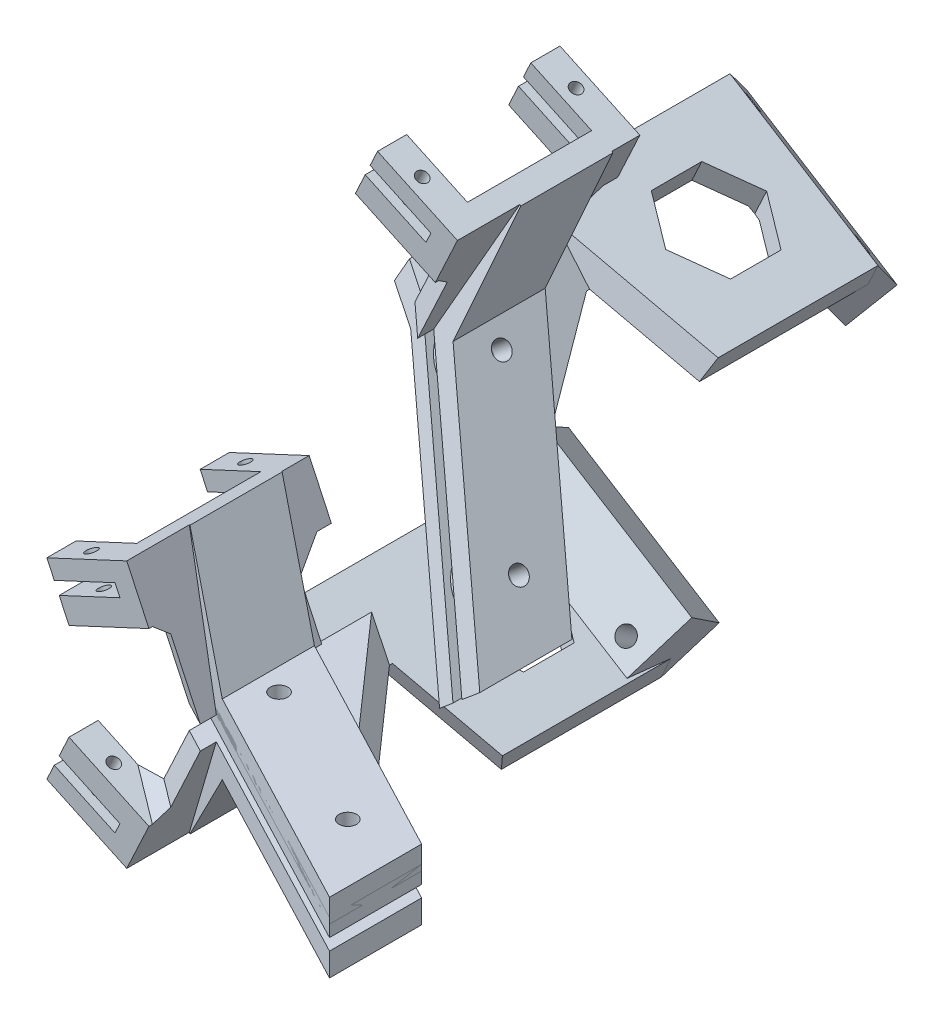
from build123d import *

# Parameters (mm, degrees)
BOSS_EXTRUDE1_DEPTH             = 3
SKETCH1_R                       = 6
BOSS_EXTRUDE3_DEPTH             = 2
SKETCH4_R                       = 1.5
CUT_EXTRUDE1_DEPTH              = 44.812962497
SKETCH5_R                       = 3.25
CUT_EXTRUDE2_DEPTH              = 2
SKETCH6_R                       = 1.5
BOSS_EXTRUDE4_DEPTH             = 4
CUT_EXTRUDE3_DEPTH              = 48.222467532
CUT_EXTRUDE3_DEPTH_BACK         = 48.222467532
SKETCH9_W                       = 15.125231148
SKETCH9_H                       = 5
SKETCH9_R                       = 1
BOSS_EXTRUDE6_DEPTH             = 4
SKETCH10_W                      = 3.625231148
SKETCH10_H                      = 31.3
BOSS_EXTRUDE7_DEPTH             = 2
SKETCH11_R                      = 1
BOSS_EXTRUDE8_DEPTH             = 3
CHAMFER2_SIZE                   = 4
CHAMFER3_SIZE                   = 2
CHAMFER4_SIZE                   = 4
CHAMFER4_SIZE_2                 = 20
BOSS_EXTRUDE9_DEPTH             = 52
BOSS_EXTRUDE9_DIRECTION_2_REACH = 51.204
SKETCH19_R                      = 3.25
CUT_EXTRUDE4_DEPTH              = 67.995097798
SKETCH20_R                      = 1.5
CUT_EXTRUDE5_DEPTH              = 67.995097798
BOSS_EXTRUDE10_DEPTH            = 27
BOSS_EXTRUDE12_DEPTH            = 4
BOSS_EXTRUDE11_DEPTH            = 31.65704896
BOSS_EXTRUDE11_START            = -16
BOSS_EXTRUDE11_2_OUTLINE_W      = 16
BOSS_EXTRUDE11_2_OUTLINE_H      = 16
BOSS_EXTRUDE11_2_DEPTH          = 1.93692213
SKETCH23_R                      = 1.5
CUT_EXTRUDE6_DEPTH              = 10
CHAMFER5_SIZE                   = 5
CHAMFER5_SIZE_2                 = 12
CHAMFER6_SIZE                   = 8
CHAMFER6_SIZE_2                 = 10.199591319
CUT_EXTRUDE7_DEPTH              = 76.916131799


with BuildPart() as part:
    # Sketch3 → Boss-Extrude1 (new body)
    with BuildSketch(Plane(origin=(0, 0, 0), x_dir=(1, 0, 0), z_dir=(0, 1, 0))):
        Polygon((-10, 13.145588768), (-10, -2.661376867), (34.799193535, -26.145588768), (34.799193535, -10.338623133), align=None)
    extrude(amount=BOSS_EXTRUDE1_DEPTH)

    # Sketch1 → Boss-Extrude3 (add)
    with BuildSketch(Plane(origin=(0, 0, 0), x_dir=(1, 0, 0), z_dir=(0, 1, 0))):
        with Locations(Location((0, 0, 0), (0, 0, 270))):
            Circle(SKETCH1_R)
        with Locations(Location((24.799193535, -13, 0), (0, 0, 270))):
            Circle(SKETCH1_R)
    extrude(amount=-BOSS_EXTRUDE3_DEPTH)

    # Sketch4 → Cut-Extrude1 (cut, through all)
    with BuildSketch(Plane(origin=(0, 3, 0), x_dir=(1, 0, 0), z_dir=(0, 1, 0))):
        with Locations(Location((0, 0, 0), (0, 0, 270))):
            Circle(SKETCH4_R)
        with Locations(Location((24.799193535, -13, 0), (0, 0, 270))):
            Circle(SKETCH4_R)
    extrude(amount=-CUT_EXTRUDE1_DEPTH, mode=Mode.SUBTRACT)

    # Sketch5 → Cut-Extrude2 (cut)
    with BuildSketch(Plane(origin=(0, 3, 0), x_dir=(1, 0, 0), z_dir=(0, 1, 0))):
        with Locations(Location((0, 0, 0), (0, 0, 270))):
            Circle(SKETCH5_R)
        with Locations(Location((24.799193535, -13, 0), (0, 0, 270))):
            Circle(SKETCH5_R)
    extrude(amount=-CUT_EXTRUDE2_DEPTH, mode=Mode.SUBTRACT)

    # Sketch18 → Boss-Extrude9 (add)
    with BuildSketch(Plane.XY):
        Polygon((-10, 0), (-14.531538935, 2.113091309), (-12.841065888, 5.738322457), (-0.535193667, 0), align=None)
    extrude(amount=-BOSS_EXTRUDE9_DEPTH)

    # Boss-Extrude9 direction 2: up to this plane
    boss_extrude9_direction_2_end = Plane(origin=(-10, 3, 2.661376867), z_dir=(0.4642857142857141, 0, -0.8856854834026605))
    # Sketch18 → Boss-Extrude9 direction 2 (add, up to the surface)
    with BuildSketch(Plane.XY, mode=Mode.PRIVATE) as boss_extrude9_direction_2_sk1:
        Polygon((-10, 0), (-14.531538935, 2.113091309), (-12.841065888, 5.738322457), (-0.535193667, 0), align=None)
    boss_extrude9_direction_2_tool1 = split(extrude(boss_extrude9_direction_2_sk1.sketch, amount=BOSS_EXTRUDE9_DIRECTION_2_REACH, mode=Mode.PRIVATE), bisect_by=boss_extrude9_direction_2_end, keep=Keep.BOTH, mode=Mode.PRIVATE)
    add(boss_extrude9_direction_2_tool1.solids().sort_by_distance((-9.047723, 2.102343, 0))[0])

    # Sketch19 → Cut-Extrude4 (cut, through all)
    with BuildSketch(Plane(origin=(0, 1, 0), x_dir=(1, 0, 0), z_dir=(0, 1, 0))):
        with Locations(Location((0, 0, 0), (0, 0, 270))):
            Circle(SKETCH19_R)
    extrude(amount=CUT_EXTRUDE4_DEPTH, mode=Mode.SUBTRACT)

    # Sketch20 → Cut-Extrude5 (cut, through all)
    with BuildSketch(Plane(origin=(0, 1, 0), x_dir=(1, 0, 0), z_dir=(0, 1, 0))):
        with Locations(Location((0, 0, 0), (0, 0, 90))):
            Circle(SKETCH20_R)
    extrude(amount=-CUT_EXTRUDE5_DEPTH, mode=Mode.SUBTRACT)

    # Sketch21 → Boss-Extrude10 (add, through all)
    with BuildSketch(Plane.XY.offset(-25)):
        Polygon((-0.535193667, 0), (15.25447551, -7.362843657), (13.564002463, -10.988074805), (-10, 0), align=None)
    extrude(amount=-BOSS_EXTRUDE10_DEPTH)

    # Sketch25 → Boss-Extrude12 (add)
    with BuildSketch(Plane(origin=(-1.786061952, -3.830222216, 0), x_dir=(0.9063077870366528, -0.4226182617406934, 0), z_dir=(-0.4226182617406934, -0.9063077870366528, 0))):
        Polygon((16.93692213, -52), (-14.06307787, -54.712148569), (-14.06307787, -52), align=None)
    extrude(amount=-BOSS_EXTRUDE12_DEPTH)

    # Boss-Extrude11: read off the stored shape, not the designer's step
    # Boss-Extrude11 outline → Boss-Extrude11 (add)
    with BuildSketch(Plane(origin=(19.457540688, -9.073200232, -103.802124301), x_dir=(-0.07898992833715975, 0.03683360850073174, 0.9961946980917462), z_dir=(-0.9028590122851758, 0.42101007166283105, -0.08715574274765152))):
        Polygon((45.843385247, 3.653924919), (52, -4.226182617), (52, -0.226182617), (59.027003215, -0.226182617), (52.147471276, 8.579216721), align=None)
    extrude(amount=BOSS_EXTRUDE11_DEPTH)

    # Boss-Extrude11 2 outline → Boss-Extrude11 2 (cut)
    with BuildSketch(Plane(origin=(0, 0, 0), x_dir=(0.42261826174069306, 0.9063077870366529, 0), z_dir=(0.906307787036653, -0.422618261740693, 0)).offset(BOSS_EXTRUDE11_START)):
        with Locations((2, -54)):
            Rectangle(BOSS_EXTRUDE11_2_OUTLINE_W, BOSS_EXTRUDE11_2_OUTLINE_H)
    extrude(amount=BOSS_EXTRUDE11_2_DEPTH, mode=Mode.SUBTRACT)

    # Sketch23 → Cut-Extrude6 (cut)
    with BuildSketch(Plane(origin=(-8.825520652, -26.172017209, -35.000355518), x_dir=(-0.9794918752400077, 0.08773549146275433, 0.18137847137023272), z_dir=(-0.19794486956653373, -0.5870040688588303, -0.7850121347823011))):
        with Locations(Location((-20.854864682, 24.981647096, 0), (0, 0, 92.198142173))):
            Circle(SKETCH23_R)
        with Locations(Location((-0.028999087, 34.742964743, 0), (0, 0, 92.198142173))):
            Circle(SKETCH23_R)
    extrude(amount=-CUT_EXTRUDE6_DEPTH, mode=Mode.SUBTRACT)

    # Chamfer5
    # the kernel refuses this chamfer: 12, 5 mm, written as the material it adds along each edge
    with BuildSketch(Plane(origin=(-41.111115995, 0, -25), x_dir=(0, 0, 1), z_dir=(1, 0, 0))) as chamfer5_piece_1_section:
        Polygon((CHAMFER5_SIZE, 0), (0, CHAMFER5_SIZE_2), (0, 0), align=None)
    chamfer5_piece_1 = extrude(amount=71.687038323, mode=Mode.PRIVATE)
    chamfer5_piece_1 = split(chamfer5_piece_1, bisect_by=Plane(origin=(-35.55447794, 11.916248764, -25), z_dir=(0.42261826174069345, 0.9063077870366528, 0)), keep=Keep.TOP, mode=Mode.PRIVATE)
    chamfer5_piece_1 = split(chamfer5_piece_1, bisect_by=Plane(origin=(-33.864004893, 15.541479912, -25), z_dir=(-0.4226182617406936, -0.9063077870366527, 0)), keep=Keep.TOP, mode=Mode.PRIVATE)
    chamfer5_piece_1 = split(chamfer5_piece_1, bisect_by=Plane(origin=(8.007364408, -22.904323569, -25), z_dir=(-0.9063077870366527, 0.42261826174069367, 0)), keep=Keep.TOP, mode=Mode.PRIVATE)
    add(chamfer5_piece_1)

    # Chamfer6
    # the kernel refuses this chamfer: 10.199591319, 8 mm, written as the material it adds along each edge
    with BuildSketch(Plane(origin=(-28.542352588, 13.059952688, -22.865686452), x_dir=(0.3380903670844996, 0.9242749779914557, 0.17723055251158748), z_dir=(0.8186169306793456, -0.381727343871112, 0.42912766835317584))) as chamfer6_piece_1_section:
        Polygon((CHAMFER6_SIZE, 0), (-CHAMFER6_SIZE_2 * 0.196215621528, -CHAMFER6_SIZE_2 * 0.98056077319), (0, 0), align=None)
    chamfer6_piece_1 = extrude(amount=60.566542446, mode=Mode.PRIVATE)
    chamfer6_piece_1 = split(chamfer6_piece_1, bisect_by=Plane(origin=(-28.542352588, 0, -22.865686452), z_dir=(0, 1, 0)), keep=Keep.TOP, mode=Mode.PRIVATE)
    chamfer6_piece_1 = split(chamfer6_piece_1, bisect_by=Plane(origin=(-28.542352588, 3, -22.865686452), z_dir=(0, -1, 0)), keep=Keep.TOP, mode=Mode.PRIVATE)
    add(chamfer6_piece_1)

    # Sketch24 → Cut-Extrude7 (cut, through all)
    with BuildSketch(Plane(origin=(-1.786061952, -3.830222216, 0), x_dir=(0.9063077870366528, -0.4226182617406934, 0), z_dir=(-0.4226182617406934, -0.9063077870366528, 0))):
        Polygon((1.43692213, -46.949436289), (8.93692213, -42.61930927), (8.93692213, -33.959055232), (1.43692213, -29.628928213), (-6.06307787, -33.959055232), (-6.06307787, -42.61930927), align=None)
    extrude(amount=-CUT_EXTRUDE7_DEPTH, mode=Mode.SUBTRACT)


with BuildPart() as body_2:
    # Sketch6 → Boss-Extrude4 (new body)
    with BuildSketch(Plane.XZ.offset(2)):
        Polygon((-10, 2.661376867), (-10, -13.145588768), (34.799193535, 10.338623133), (34.799193535, 26.145588768), align=None)
        with Locations(Location((0, 0, 0), (0, 0, 270))):
            Circle(SKETCH6_R, mode=Mode.SUBTRACT)
        with Locations(Location((24.799193535, 13, 0), (0, 0, 270))):
            Circle(SKETCH6_R, mode=Mode.SUBTRACT)
    extrude(amount=BOSS_EXTRUDE4_DEPTH)

    # Sketch16 → Loft1 section 0
    with BuildSketch(Plane(origin=(0, -18.313540167, 0), x_dir=(-1, 0, 0), z_dir=(0, -1, 0))):
        with BuildLine():
            Line((13.607128711, -7.50473643), (13.607128711, 13.79526357))
            Line((13.607128711, 13.79526357), (17.607128711, 15.892105951))
            Line((17.607128711, 15.892105951), (17.607128711, -5.407894049))
            Line((17.607128711, -5.407894049), (13.607128711, -7.50473643))
        make_face()
    # Sketch7 → Loft1 section 1
    with BuildSketch(Plane(origin=(0, -2, 0), x_dir=(1, 0, 0), z_dir=(0, 1, 0))):
        with BuildLine():
            Line((-10, 15.892105951), (-10, -5.407894049))
            Line((-10, -5.407894049), (-6, -7.50473643))
            Line((-6, -7.50473643), (-6, 13.79526357))
            Line((-6, 13.79526357), (-10, 15.892105951))
        make_face()
    loft()

    # Sketch17 → Cut-Extrude3 (cut, two sides: drawn at the far end of the back side and taken through both)
    with BuildSketch(Plane.XY.offset(-CUT_EXTRUDE3_DEPTH_BACK)):
        Polygon((-17.607128711, -18.313540167), (-13.607128711, -18.313540167), (-16.892703931, -16.78145128), align=None)
    extrude(amount=CUT_EXTRUDE3_DEPTH + CUT_EXTRUDE3_DEPTH_BACK, mode=Mode.SUBTRACT)

    # Sketch9 → Boss-Extrude6 (add)
    # profile 1 of 2: a face of its own
    with BuildSketch(Plane(origin=(-26.705419865, -12.205706693, 0), x_dir=(-0.9063077870366525, 0.42261826174069417, 0), z_dir=(0.4226182617406941, 0.9063077870366524, 0))):
        with Locations((-6.889749661, 7.907894049)):
            Rectangle(SKETCH9_W, SKETCH9_H)
        with Locations(Location((-5.077134087, 7.957894049, 0), (0, 0, 180))):
            Circle(SKETCH9_R, mode=Mode.SUBTRACT)
    # profile 2 of 2: a face of its own
    with BuildSketch(Plane(origin=(-26.705419865, -12.205706693, 0), x_dir=(-0.9063077870366525, 0.42261826174069417, 0), z_dir=(0.4226182617406941, 0.9063077870366524, 0))):
        Polygon((-10.827134087, -15.892105951), (0.672865913, -15.892105951), (0.672865913, -20.892105951), (-14.452365235, -20.892105951), (-14.452365235, -15.892105951), (-14.452365235, -13.79526357), align=None)
        with Locations(Location((-5.077134087, -18.442105951, 0), (0, 0, 180))):
            Circle(SKETCH9_R, mode=Mode.SUBTRACT)
    extrude(amount=BOSS_EXTRUDE6_DEPTH)

    # Sketch10 → Boss-Extrude7 (add)
    with BuildSketch(Plane(origin=(-50.114461272, -1.289891415, 0), x_dir=(-0.9063077870366525, 0.42261826174069417, 0), z_dir=(0.4226182617406941, 0.9063077870366524, 0))):
        with Locations((-38.468769054, -5.242105951)):
            Rectangle(SKETCH10_W, SKETCH10_H)
    extrude(amount=-BOSS_EXTRUDE7_DEPTH)

    # Sketch11 → Boss-Extrude8 (add)
    with BuildSketch(Plane(origin=(-10.290046849, -22.06707668, 0), x_dir=(0.9063077870366528, -0.4226182617406936, 0), z_dir=(-0.4226182617406936, -0.9063077870366528, 0))):
        Polygon((-19.717841347, 10.407894049), (-4.592610199, 10.407894049), (-4.592610199, -20.892105951), (-19.717841347, -20.892105951), (-19.717841347, -15.892105951), (-8.217841347, -15.892105951), (-8.217841347, 5.407894049), (-19.717841347, 5.407894049), align=None)
        with Locations((-13.967841347, -18.442105951)):
            Circle(SKETCH11_R, mode=Mode.SUBTRACT)
        with Locations((-13.967841347, 7.957894049)):
            Circle(SKETCH11_R, mode=Mode.SUBTRACT)
    extrude(amount=BOSS_EXTRUDE8_DEPTH)

    # Chamfer2
    # the kernel refuses this chamfer: 4 mm, written as the material it adds along each edge
    with BuildSketch(Plane(origin=(-3.8464274, -18.451518261, -8.644872691), x_dir=(0.4537728193833932, -0.2115977407410584, -0.8656307668412245), z_dir=(-0.7845279046867107, 0.36583136999170246, -0.5006829091329899))) as chamfer2_piece_1_section:
        Polygon((CHAMFER2_SIZE, 0), (0, -CHAMFER2_SIZE), (0, 0), align=None)
    chamfer2_piece_1 = extrude(amount=24.761428665, mode=Mode.PRIVATE)
    chamfer2_piece_1 = split(chamfer2_piece_1, bisect_by=Plane(origin=(-11.916655664, -14.688309019, -8.644872691), z_dir=(-0.9063077870366527, 0.4226182617406936, 0)), keep=Keep.TOP, mode=Mode.PRIVATE)
    chamfer2_piece_1 = split(chamfer2_piece_1, bisect_by=Plane(origin=(-15.202230884, -13.156220132, -8.644872691), z_dir=(0.9063077870366528, -0.4226182617406935, 0)), keep=Keep.TOP, mode=Mode.PRIVATE)
    add(chamfer2_piece_1)

    # Chamfer3
    # the kernel refuses this chamfer: 2 mm, written as the material it adds along each edge
    with BuildSketch(Plane(origin=(-7.881541532, -16.56991364, 10.079931869), x_dir=(0.42261826174069367, 0.9063077870366528, 0), z_dir=(-0.7845279046867109, 0.36583136999170235, -0.5006829091329895))) as chamfer3_piece_1_section:
        Polygon((CHAMFER3_SIZE, 0), (0, -CHAMFER3_SIZE), (0, 0), align=None)
    chamfer3_piece_1 = extrude(amount=14.474696714, mode=Mode.PRIVATE)
    chamfer3_piece_1 = split(chamfer3_piece_1, bisect_by=Plane(origin=(-11.916655664, -14.688309019, 10.079931869), z_dir=(-0.9063077870365974, 0.42261826174081224, 0)), keep=Keep.TOP, mode=Mode.PRIVATE)
    chamfer3_piece_1 = split(chamfer3_piece_1, bisect_by=Plane(origin=(-15.202230884, -13.156220132, 10.079931869), z_dir=(0.9063077870365974, -0.42261826174081224, 0)), keep=Keep.TOP, mode=Mode.PRIVATE)
    chamfer3_piece_1 = split(chamfer3_piece_1, bisect_by=Plane(origin=(-7.881541532, -16.56991364, 5.407894049), z_dir=(0, 0, 1)), keep=Keep.TOP, mode=Mode.PRIVATE)
    add(chamfer3_piece_1)
    with BuildSketch(Plane(origin=(-7.881541532, -16.56991364, 10.079931869), x_dir=(0.42261826174069367, 0.9063077870366528, 0), z_dir=(-0.7845279046867109, 0.36583136999170235, -0.5006829091329895))) as chamfer3_piece_2_section:
        Polygon((CHAMFER3_SIZE, 0), (0, -CHAMFER3_SIZE), (0, 0), align=None)
    chamfer3_piece_2 = extrude(amount=14.474696714, mode=Mode.PRIVATE)
    chamfer3_piece_2 = split(chamfer3_piece_2, bisect_by=Plane(origin=(-15.202230884, -13.156220132, 10.079931869), z_dir=(-0.9063077870365974, 0.42261826174081224, 0)), keep=Keep.TOP, mode=Mode.PRIVATE)
    chamfer3_piece_2 = split(chamfer3_piece_2, bisect_by=Plane(origin=(-7.881541532, -16.56991364, 5.407894049), z_dir=(0, 0, 1)), keep=Keep.TOP, mode=Mode.PRIVATE)
    add(chamfer3_piece_2)

    # Chamfer4
    # the kernel refuses this chamfer: 20, 4 mm, written as the material it adds along each edge
    with BuildSketch(Plane(origin=(-7.865230633, -6, -64.000203695), x_dir=(1, 0, 0), z_dir=(0, 0, 1))) as chamfer4_piece_1_section:
        Polygon((CHAMFER4_SIZE, 0), (-CHAMFER4_SIZE_2 * 0.422618261741, -CHAMFER4_SIZE_2 * 0.906307787037), (0, 0), align=None)
    chamfer4_piece_1 = extrude(amount=119.75433293, mode=Mode.PRIVATE)
    chamfer4_piece_1 = split(chamfer4_piece_1, bisect_by=Plane(origin=(-35.737387155, -6, -10.830434169), z_dir=(0.4642857142857141, 0, -0.8856854834026604)), keep=Keep.TOP, mode=Mode.PRIVATE)
    chamfer4_piece_1 = split(chamfer4_piece_1, bisect_by=Plane(origin=(-29.237387155, -6, -23.230030936), z_dir=(-0.4642857142857143, 0, 0.8856854834026603)), keep=Keep.TOP, mode=Mode.PRIVATE)
    chamfer4_piece_1 = split(chamfer4_piece_1, bisect_by=Plane(origin=(-15.72022002, -22.845079102, -64.000203695), z_dir=(0.4226182617406936, 0.9063077870366527, 0)), keep=Keep.TOP, mode=Mode.PRIVATE)
    add(chamfer4_piece_1)


with BuildPart() as body_3:
    # Mirror1: mirrored copy
    add(body_2.part.mirror(Plane.ZX))


with BuildPart() as body_4:
    # Mirror2: mirrored copy
    add(part.part.mirror(Plane(origin=(16.809141565, 36.047320414, 0), x_dir=(0, 0, 1), z_dir=(0.4226182617406937, 0.9063077870366527, 0))))


with BuildPart() as body_5:
    # Mirror5: mirrored copy
    add(body_2.part.mirror(Plane(origin=(16.809141565, 36.047320414, 0), x_dir=(0, 0, 1), z_dir=(0.4226182617406937, 0.9063077870366527, 0))))


solid = Compound([part.part, body_2.part, body_3.part, body_4.part, body_5.part])
